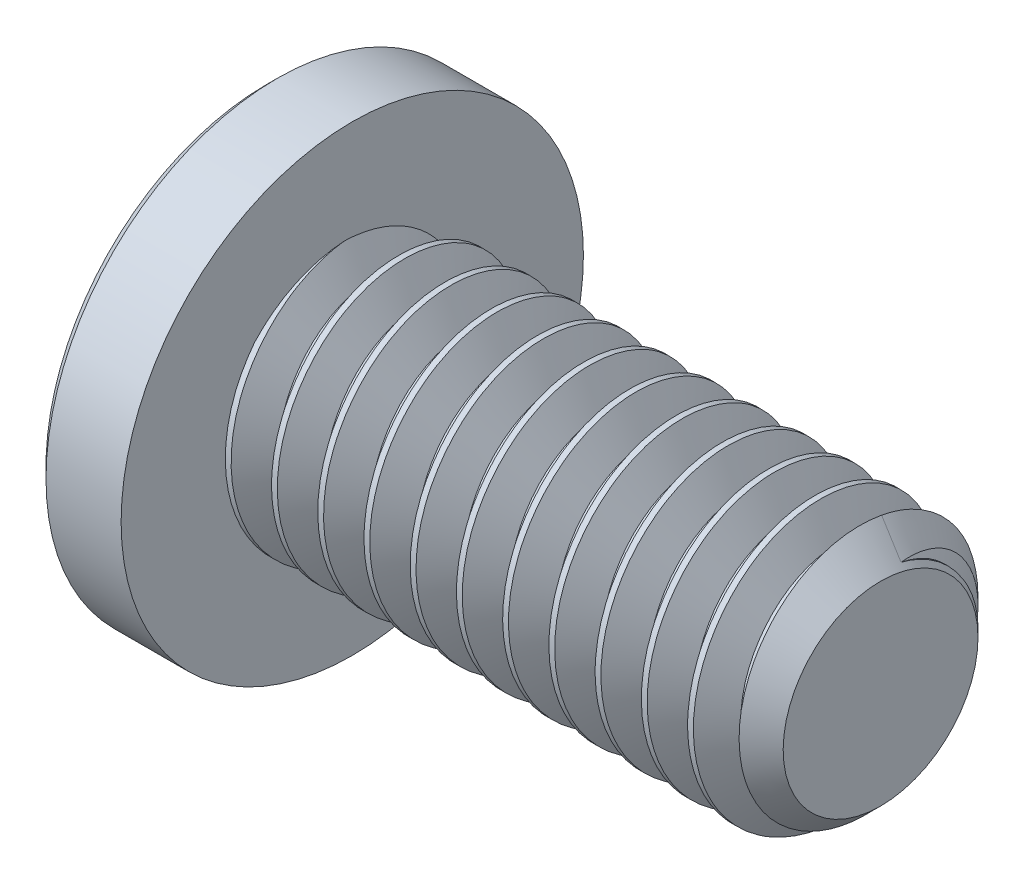
from build123d import *

# Parameters (mm, degrees)
SKETCH2_R           = 2
BOSS_EXTRUDE1_DEPTH = 8
CHAMFER1_SIZE       = 0.525
CUT_SWEEP1_PITCH    = 0.7
CUT_EXTRUDE1_DEPTH  = 2.42


with BuildPart() as part:
    # Sketch2 → Boss-Extrude1 (new body)
    with BuildSketch(Plane(origin=(4, 0, 0), x_dir=(0, 0, -1), z_dir=(1, 0, 0))):
        Circle(SKETCH2_R)
    extrude(amount=-BOSS_EXTRUDE1_DEPTH)

    # Chamfer1
    chamfer1_edges = [part.edges().sort_by_distance(p)[0] for p in [
        (4, 0, 2),
    ]]
    chamfer(chamfer1_edges, length=CHAMFER1_SIZE)

    # Cut-Sweep1: the profile of Sketch5 profile screwed along a right-hand helix of 12.428571 turns, 6 arcs to a turn; built about Z, then put on its axis
    cut_sweep1_z = Axis((0, 0, 0), (0, 0, 1))
    cut_sweep1_corners = [(2.0003, 0, 0.306423205), (2.0003, 0, -0.306423205), (1.545336663, 0, -0.04375), (1.545336663, 0, 0.04375)]
    with BuildLine(mode=Mode.PRIVATE) as cut_sweep1_profile:
        Line(cut_sweep1_corners[0], cut_sweep1_corners[1])
        Line(cut_sweep1_corners[1], cut_sweep1_corners[2])
        Line(cut_sweep1_corners[2], cut_sweep1_corners[3])
        Line(cut_sweep1_corners[3], cut_sweep1_corners[0])
    cut_sweep1_cap = Face(cut_sweep1_profile.wire())
    cut_sweep1_turn_angles = [0, 30, 60, 90, 120, 150, 180, 210, 240, 270, 300, 330, 360]
    cut_sweep1_turn_weights = [1, 0.8660254037844387, 1, 0.8660254037844387, 1, 0.8660254037844387, 1, 0.8660254037844387, 1, 0.8660254037844387, 1, 0.8660254037844387, 1]
    cut_sweep1_turn_rails = [Edge.make_bspline([Vector(p[0], p[1], 0).rotate(cut_sweep1_z, cut_sweep1_turn_angles[k]) / cut_sweep1_turn_weights[k] + Vector(0, 0, p[2] + CUT_SWEEP1_PITCH * cut_sweep1_turn_angles[k] / 360) for k in range(13)], [0, 0, 0, 1, 1, 2, 2, 3, 3, 4, 4, 5, 5, 6, 6, 6], 2, cut_sweep1_turn_weights) for p in cut_sweep1_corners]
    cut_sweep1_turn_sides = [Face.make_surface_from_curves(cut_sweep1_turn_rails[p[0]], cut_sweep1_turn_rails[p[1]]) for p in [(0, 1), (1, 2), (2, 3), (3, 0)]]
    cut_sweep1_last_angles = [4320, 4350, 4380, 4410, 4440, 4457.142857143, 4474.285714286]
    cut_sweep1_last_weights = [1, 0.8660254037844387, 1, 0.8660254037844387, 1, 0.9555728057861561, 1]
    cut_sweep1_last_rails = [Edge.make_bspline([Vector(p[0], p[1], 0).rotate(cut_sweep1_z, cut_sweep1_last_angles[k]) / cut_sweep1_last_weights[k] + Vector(0, 0, p[2] + CUT_SWEEP1_PITCH * cut_sweep1_last_angles[k] / 360) for k in range(7)], [0, 0, 0, 1, 1, 2, 2, 3, 3, 3], 2, cut_sweep1_last_weights) for p in cut_sweep1_corners]
    cut_sweep1_last_sides = [Face.make_surface_from_curves(cut_sweep1_last_rails[p[0]], cut_sweep1_last_rails[p[1]]) for p in [(0, 1), (1, 2), (2, 3), (3, 0)]]
    cut_sweep1 = Plane(origin=(4, 0, 0), x_dir=(0, 1, 0), z_dir=(-1, 0, 0)) * Solid(Shell([*[p.moved(Location((0, 0, CUT_SWEEP1_PITCH * i))) for i in range(12) for p in cut_sweep1_turn_sides], *cut_sweep1_last_sides, cut_sweep1_cap, cut_sweep1_cap.rotate(cut_sweep1_z, 4474.285714286).moved(Location((0, 0, CUT_SWEEP1_PITCH * 4474.285714286 / 360)))]))
    add(cut_sweep1, mode=Mode.SUBTRACT)

    # Sketch6 → Revolve1 (revolve)
    with BuildSketch(Plane.XY, mode=Mode.PRIVATE) as revolve1_sk:
        Polygon((-5.1375, 3.5), (-5.3, 3.3375), (-5.3, 0), (-4, 0), (-4, 3.5), align=None)
    revolve(revolve1_sk.sketch.rotate(Axis((-4, 0, 0), (-1, 0, 0)), 14.209880149), axis=Axis((-4, 0, 0), (-1, 0, 0)))

    # Sketch4 → Cut-Extrude1 (cut)
    with BuildSketch(Plane(origin=(-5.3, 0, 0), x_dir=(0, 0, -1), z_dir=(1, 0, 0))):
        Polygon((0, 1.443375673), (-1.25, 0.721687836), (-1.25, -0.721687836), (0, -1.443375673), (1.25, -0.721687836), (1.25, 0.721687836), align=None)
    extrude(amount=CUT_EXTRUDE1_DEPTH, mode=Mode.SUBTRACT)

    # Cut-Extrude2 cone 1 section (through the dimple's axis) → Cut-Extrude2 (revolve, cut)
    with BuildSketch(Plane(origin=(-5.3, 0, 0), x_dir=(0, 0, 1), z_dir=(0, 1, 0))):
        Polygon((0, 0), (1.443375673, 0), (0, 1.443375673), align=None)
    revolve(axis=Axis((-5.3, 0, 0), (1, 0, 0)), mode=Mode.SUBTRACT)


solid = part.part
